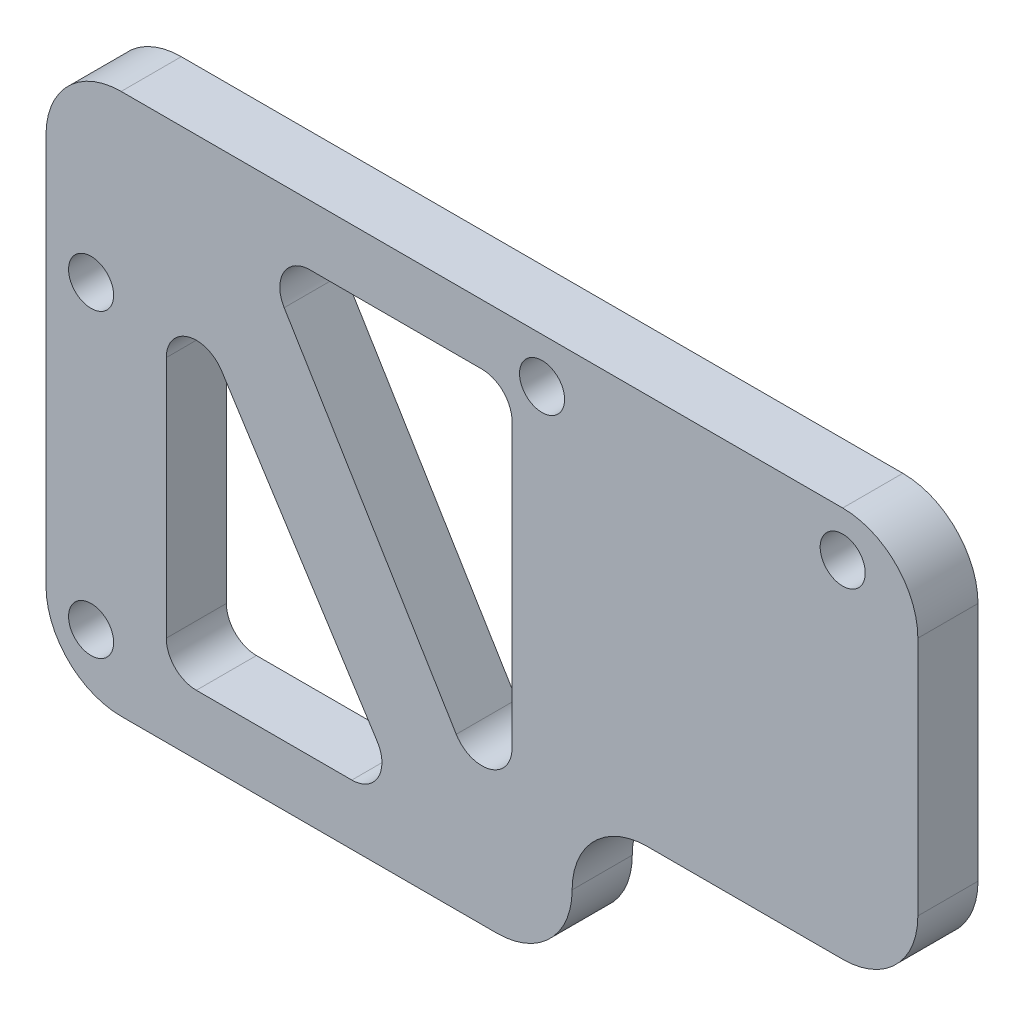
from build123d import *

# Parameters (mm, degrees)
EXTRUDE_2_DEPTH      = 4
SKETCH_2_R           = 1.5
CUT_EXTRUDE_1_DEPTH  = 10
SKETCH_4_W           = 100
SKETCH_4_H           = 10
CUT_EXTRUDE_2_DEPTH  = 10
FILLET_1_R           = 5
SKETCH_5_R           = 1.5
CUT_EXTRUDE_3_DEPTH  = 6
SKETCH_7_W           = 4
SKETCH_7_H           = 25.94
EXTRUDE_3_DEPTH      = 2
FILLET_5_R           = 1
SKETCH_9_R           = 1.5
CUT_EXTRUDE_6_DEPTH  = 10
SKETCH_13_R          = 1.5
CUT_EXTRUDE_8_DEPTH  = 10
CUT_EXTRUDE_9_DEPTH  = 4
FILLET_9_R           = 2
SKETCH_15_W          = 4
SKETCH_15_H          = 25.94
CUT_EXTRUDE_12_DEPTH = 10
SKETCH_16_W          = 77
SKETCH_16_H          = 26
CUT_EXTRUDE_13_DEPTH = 10
FILLET_10_R          = 5


with BuildPart() as part:
    # 草图1 → 凸台-拉伸2 (new body)
    with BuildSketch(Plane.XY):
        Polygon((0, 0), (0, 36), (35, 36), (135, 36), (135, 16.447466896), (135, 0), align=None)
    extrude(amount=EXTRUDE_2_DEPTH)

    # 草图2 → 切除-拉伸1 (cut)
    with BuildSketch(Plane.XY.offset(4)):
        with Locations((3, 4)):
            Circle(SKETCH_2_R)
        with Locations((3, 24)):
            Circle(SKETCH_2_R)
    extrude(amount=-CUT_EXTRUDE_1_DEPTH, mode=Mode.SUBTRACT)

    # 草图4 → 切除-拉伸2 (cut)
    with BuildSketch(Plane.XY.offset(4)):
        with Locations((85, 5)):
            Rectangle(SKETCH_4_W, SKETCH_4_H)
    extrude(amount=-CUT_EXTRUDE_2_DEPTH, mode=Mode.SUBTRACT)

    # 圆角1
    fillet_1_edges = [part.edges().sort_by_distance(p)[0] for p in [
        (35, 10, 2),
        (135, 10, 2),
        (135, 36, 2),
        (0, 36, 2),
        (0, 0, 2),
        (35, 0, 2),
    ]]
    fillet(fillet_1_edges, radius=FILLET_1_R - 0.0001)  # a hair under: the kernel refuses the full size

    # 草图5 → 切除-拉伸3 (cut)
    with BuildSketch(Plane.XY.offset(4)):
        with Locations((97.5, 33)):
            Circle(SKETCH_5_R)
        with Locations((53, 33)):
            Circle(SKETCH_5_R)
        with Locations((77.5, 33)):
            Circle(SKETCH_5_R)
    extrude(amount=-CUT_EXTRUDE_3_DEPTH, mode=Mode.SUBTRACT)

    # 草图7 → 凸台-拉伸3 (add)
    with BuildSketch(Plane.XY.offset(4)):
        with Locations((-2, 18)):
            Rectangle(SKETCH_7_W, SKETCH_7_H)
    extrude(amount=-EXTRUDE_3_DEPTH)

    # 圆角5
    fillet_5_edges = [part.edges().sort_by_distance(p)[0] for p in [
        (-4, 5.03, 3),
        (-4, 30.97, 3),
    ]]
    fillet(fillet_5_edges, radius=FILLET_5_R)

    # 草图9 → 切除-拉伸6 (cut)
    with BuildSketch(Plane.XY.offset(4)):
        with Locations((110, 17)):
            Circle(SKETCH_9_R)
    extrude(amount=-CUT_EXTRUDE_6_DEPTH, mode=Mode.SUBTRACT)

    # 草图13 → 切除-拉伸8 (cut)
    with BuildSketch(Plane.XY.offset(4)):
        with Locations((33, 33)):
            Circle(SKETCH_13_R)
    extrude(amount=-CUT_EXTRUDE_8_DEPTH, mode=Mode.SUBTRACT)

    # 草图11 → 切除-拉伸9 (cut)
    with BuildSketch(Plane.XY.offset(4)):
        Polygon((31, 4), (14, 32), (31, 32), align=None)
        Polygon((8, 4), (24, 4), (8, 29), align=None)
    extrude(amount=-CUT_EXTRUDE_9_DEPTH, mode=Mode.SUBTRACT)

    # 圆角9
    fillet_9_edges = [part.edges().sort_by_distance(p)[0] for p in [
        (8, 29, 2),
        (8, 4, 2),
        (24, 4, 2),
        (31, 4, 2),
        (14, 32, 2),
        (31, 32, 2),
    ]]
    fillet(fillet_9_edges, radius=FILLET_9_R)

    # 草图15 → 切除-拉伸12 (cut)
    with BuildSketch(Plane.XY.offset(4)):
        with Locations((-2, 18)):
            Rectangle(SKETCH_15_W, SKETCH_15_H)
    extrude(amount=-CUT_EXTRUDE_12_DEPTH, mode=Mode.SUBTRACT)

    # 草图16 → 切除-拉伸13 (cut)
    with BuildSketch(Plane.XY.offset(4)):
        with Locations((96.5, 23)):
            Rectangle(SKETCH_16_W, SKETCH_16_H)
    extrude(amount=-CUT_EXTRUDE_13_DEPTH, mode=Mode.SUBTRACT)

    # 圆角10
    fillet_10_edges = [part.edges().sort_by_distance(p)[0] for p in [
        (58, 36, 2),
        (58, 10, 2),
    ]]
    fillet(fillet_10_edges, radius=FILLET_10_R)


solid = part.part
